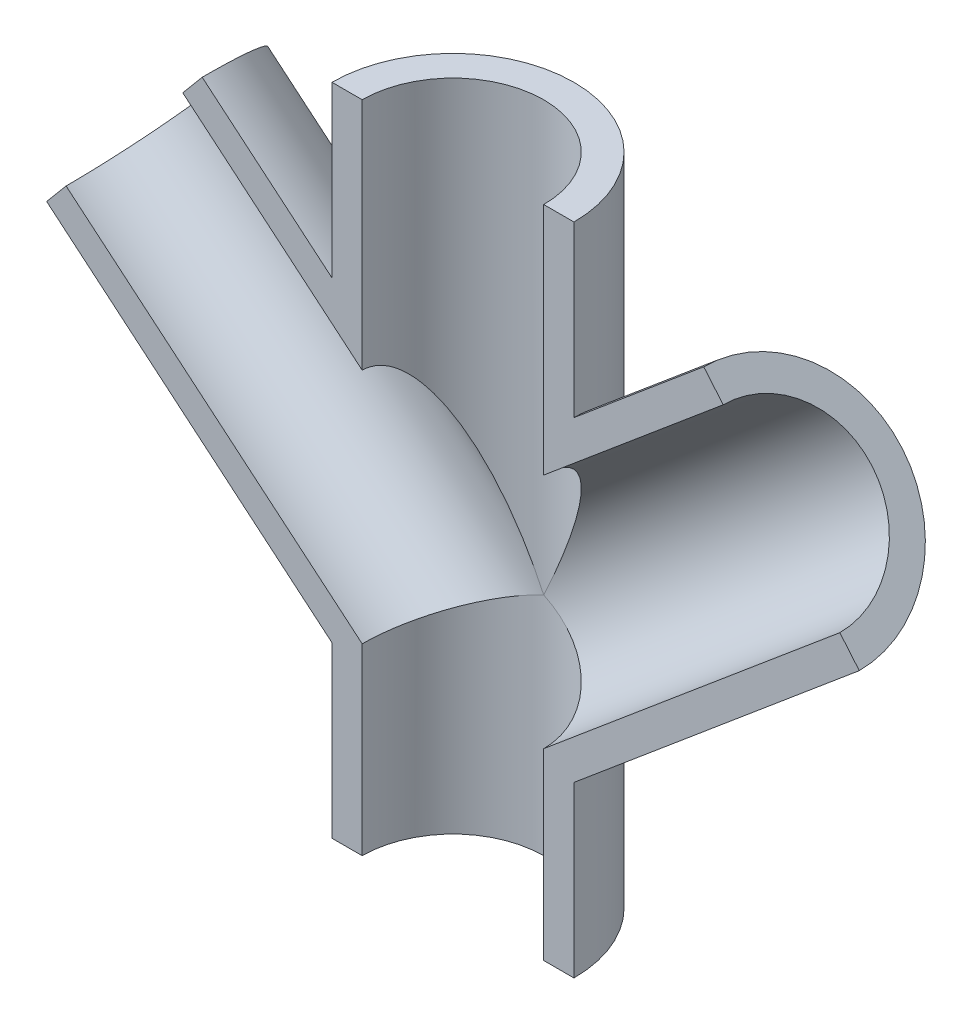
from build123d import *

# Parameters (mm, degrees)
EXTRUDE_659_DEPTH           = 5
SKETCH_4_R                  = 3.75
CUT_EXTRUDE_1016_DEPTH      = 33.230936168
CUT_EXTRUDE_1190_REACH      = 40.468
CUT_EXTRUDE_1190_END_RADIUS = 3.75
SKETCH_5_R                  = 3.75
FILLET_8_R                  = 5


with BuildPart() as part:
    # Эскиз3 → Extrude 659 (new, symmetric)
    with BuildSketch(Plane.XY):
        Polygon((-5, 7), (-16.790187199, 16.89314173), (-10.362311102, 24.553586161), (-5, 20.054072893), (-5, 27.054072893), (5, 27.054072893), (5, 20.054072893), (10.362311102, 24.553586161), (16.790187199, 16.89314173), (5, 7), (5, 0), (-5, 0), align=None)
    extrude(amount=EXTRUDE_659_DEPTH, both=True)

    # Эскиз4 → Cut-Extrude 1016 (cut, through all)
    with BuildSketch(Plane(origin=(0, 27.054072893, 0), x_dir=(-1, 0, 0), z_dir=(0, 1, 0))):
        with Locations(Location((0, 0, 0), (0, 0, 90))):
            Circle(SKETCH_4_R)
    extrude(amount=-CUT_EXTRUDE_1016_DEPTH, mode=Mode.SUBTRACT)

    # Cut-Extrude 1190: up to this cylinder (the profile starts outside it)
    cut_extrude_1190_end = Plane(origin=(0, 20.723364, 0), z_dir=(0, 1, 0)) * Cylinder(CUT_EXTRUDE_1190_END_RADIUS, 89.436, mode=Mode.PRIVATE)
    # Эскиз5 → Cut-Extrude 1190 (cut, up to the surface)
    with BuildSketch(Plane(origin=(-18.171134778, 15.247392491, 0), x_dir=(0, 0, 1), z_dir=(-0.7660444431189745, 0.6427876096865438, 0)), mode=Mode.PRIVATE) as cut_extrude_1190_sk1:
        with Locations(Location((0, 7.148373053, 0), (0, 0, 270))):
            Circle(SKETCH_5_R)
    cut_extrude_1190_tool1 = extrude(cut_extrude_1190_sk1.sketch, amount=-CUT_EXTRUDE_1190_REACH, mode=Mode.PRIVATE) - cut_extrude_1190_end
    cut_extrude_1190 = cut_extrude_1190_tool1.solids().sort_by_distance((-13.576249, 20.723364, 0))[0]
    add(cut_extrude_1190, mode=Mode.SUBTRACT)

    # Зеркальное отражение1: Cut-Extrude 1190 across plane
    add(cut_extrude_1190.mirror(Plane(origin=(0, 0, 0), x_dir=(0, 0, 1), z_dir=(1, 0, 0))), mode=Mode.SUBTRACT)

    # Скругление8
    fillet_8_edges = [part.edges().sort_by_distance(p)[0] for p in [
        (7.681155551, 22.303829527, -5),
        (5, 23.554072893, -5),
        (-5, 23.554072893, -5),
        (-7.681155551, 22.303829527, -5),
        (-10.895093599, 11.946570865, -5),
        (-5, 3.5, -5),
        (5, 3.5, -5),
        (10.895093599, 11.946570865, -5),
        (-5, 3.5, 5),
        (5, 3.5, 5),
        (10.895093599, 11.946570865, 5),
        (7.681155551, 22.303829527, 5),
        (5, 23.554072893, 5),
        (-5, 23.554072893, 5),
        (-7.681155551, 22.303829527, 5),
        (-10.895093599, 11.946570865, 5),
    ]]
    fillet(fillet_8_edges, radius=FILLET_8_R - 0.0001)  # a hair under: the kernel refuses the full size

    # Split Bodies 2695
    split(bisect_by=Plane.XY, keep=Keep.BOTTOM)


solid = part.part
